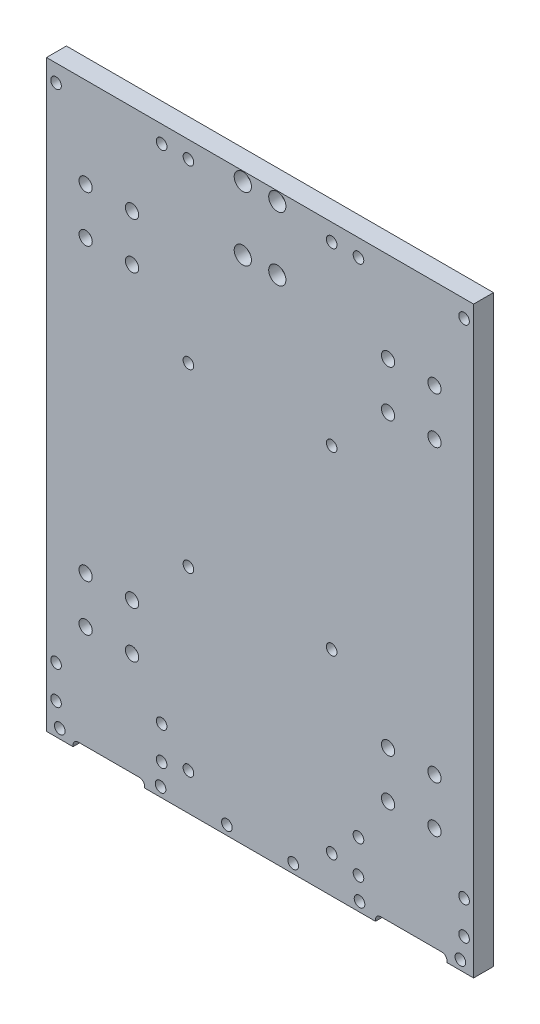
from build123d import *

# Parameters (mm, degrees)
SZKIC1_W                       = 322
SZKIC1_H                       = 440
DODANIE_WYCI_GNI_CIE1_DEPTH    = 15
SZKIC2_R                       = 3
WYTNIJ_WYCI_GNI_CIE1_DEPTH     = 15
SZKIC3_R                       = 5
WYTNIJ_WYCI_GNI_CIE2_DEPTH     = 7
SZYK_LINIOWY1_COUNT            = 2
SZYK_LINIOWY1_PITCH            = 35
SZYK_LINIOWY1_COUNT_DIR2       = 2
SZYK_LINIOWY1_PITCH_DIR2       = 35
SZYK_LINIOWY2_COPY_1_SKETCH_R  = 3
SZYK_LINIOWY2_COPY_1_DEPTH     = 15
SZYK_LINIOWY2_COPY_2_SKETCH_R  = 3
SZYK_LINIOWY2_COPY_2_DEPTH     = 15
SZYK_LINIOWY2_COPY_3_SKETCH_R  = 3
SZYK_LINIOWY2_COPY_3_DEPTH     = 15
SZYK_LINIOWY2_COPY_4_SKETCH_R  = 3
SZYK_LINIOWY2_COPY_4_DEPTH     = 15
SZYK_LINIOWY2_COPY_5_SKETCH_R  = 3
SZYK_LINIOWY2_COPY_5_DEPTH     = 15
SZYK_LINIOWY2_COPY_6_SKETCH_R  = 3
SZYK_LINIOWY2_COPY_6_DEPTH     = 15
SZYK_LINIOWY2_COPY_7_SKETCH_R  = 3
SZYK_LINIOWY2_COPY_7_DEPTH     = 15
SZYK_LINIOWY2_COPY_8_SKETCH_R  = 3
SZYK_LINIOWY2_COPY_8_DEPTH     = 15
SZYK_LINIOWY2_COPY_9_SKETCH_R  = 3
SZYK_LINIOWY2_COPY_9_DEPTH     = 15
SZYK_LINIOWY2_COPY_10_SKETCH_R = 5
SZYK_LINIOWY2_COPY_10_DEPTH    = 7
SZYK_LINIOWY2_COPY_11_SKETCH_R = 5
SZYK_LINIOWY2_COPY_11_DEPTH    = 7
SZYK_LINIOWY2_COPY_12_SKETCH_R = 5
SZYK_LINIOWY2_COPY_12_DEPTH    = 7
SZYK_LINIOWY2_COPY_13_SKETCH_R = 5
SZYK_LINIOWY2_COPY_13_DEPTH    = 7
SZYK_LINIOWY2_COPY_14_SKETCH_R = 5
SZYK_LINIOWY2_COPY_14_DEPTH    = 7
SZYK_LINIOWY2_COPY_15_SKETCH_R = 5
SZYK_LINIOWY2_COPY_15_DEPTH    = 7
SZYK_LINIOWY2_COPY_16_SKETCH_R = 5
SZYK_LINIOWY2_COPY_16_DEPTH    = 7
SZYK_LINIOWY2_COPY_17_SKETCH_R = 5
SZYK_LINIOWY2_COPY_17_DEPTH    = 7
SZYK_LINIOWY2_COPY_18_SKETCH_R = 5
SZYK_LINIOWY2_COPY_18_DEPTH    = 7
SZYK_LINIOWY2_COPY_19_SKETCH_R = 3
SZYK_LINIOWY2_COPY_19_DEPTH    = 15
SZYK_LINIOWY2_COPY_20_SKETCH_R = 3
SZYK_LINIOWY2_COPY_20_DEPTH    = 15
SZYK_LINIOWY2_COPY_21_SKETCH_R = 3
SZYK_LINIOWY2_COPY_21_DEPTH    = 15
SZYK_LINIOWY2_COPY_22_SKETCH_R = 5
SZYK_LINIOWY2_COPY_22_DEPTH    = 7
SZYK_LINIOWY2_COPY_23_SKETCH_R = 5
SZYK_LINIOWY2_COPY_23_DEPTH    = 7
SZYK_LINIOWY2_COPY_24_SKETCH_R = 5
SZYK_LINIOWY2_COPY_24_DEPTH    = 7
SZKIC6_R                       = 4
WYTNIJ_WYCI_GNI_CIE3_DEPTH     = 20
SZKIC7_R                       = 4
WYTNIJ_WYCI_GNI_CIE4_DEPTH     = 20
SZKIC10_R                      = 4
WYTNIJ_WYCI_GNI_CIE5_DEPTH     = 21
SZKIC11_R                      = 4
WYTNIJ_WYCI_GNI_CIE6_DEPTH     = 21
SZKIC12_R                      = 3.999999999
WYTNIJ_WYCI_GNI_CIE7_DEPTH     = 15
SZKIC13_R                      = 6.499999999
WYTNIJ_WYCI_GNI_CIE8_DEPTH     = 9
SZKIC14_R                      = 4
WYTNIJ_WYCI_GNI_CIE9_DEPTH     = 15
SZYK_LINIOWY3_COUNT            = 4
SZYK_LINIOWY3_PITCH            = 133
SZKIC22_W                      = 54
SZKIC22_H                      = 15
WYTNIJ_WYCI_GNI_CIE11_DEPTH    = 5
SZKIC24_W                      = 54
SZKIC24_H                      = 15
WYTNIJ_WYCI_GNI_CIE13_DEPTH    = 5
ZAOKR_GLENIE2_R                = 4
SZKIC25_R                      = 4
WYTNIJ_WYCI_GNI_CIE14_DEPTH    = 20
SZKIC26_R                      = 4
WYTNIJ_WYCI_GNI_CIE15_DEPTH    = 20
SZYK_LINIOWY4_COUNT            = 4
SZYK_LINIOWY4_PITCH            = 50


with BuildPart() as part:
    # Szkic1 → Dodanie-wyciągnięcie1 (new body)
    with BuildSketch(Plane.XY):
        Rectangle(SZKIC1_W, SZKIC1_H)
    extrude(amount=DODANIE_WYCI_GNI_CIE1_DEPTH)

    # Szkic2 → Wytnij-wyciągnięcie1 (cut)
    with BuildSketch(Plane.XY.offset(15)):
        with Locations((-131.5, 152)):
            Circle(SZKIC2_R)
    wytnij_wyci_gni_cie1 = extrude(amount=-WYTNIJ_WYCI_GNI_CIE1_DEPTH, mode=Mode.SUBTRACT)

    # Szkic3 → Wytnij-wyciągnięcie2 (cut)
    with BuildSketch(Plane.XY.offset(15)):
        with Locations((-131.5, 152)):
            Circle(SZKIC3_R)
    wytnij_wyci_gni_cie2 = extrude(amount=-WYTNIJ_WYCI_GNI_CIE2_DEPTH, mode=Mode.SUBTRACT)

    # Szyk liniowy1: Wytnij-wyciągnięcie1, Wytnij-wyci_gni_cie2 2 × 2
    with Locations(*[(i * SZYK_LINIOWY1_PITCH, -j * SZYK_LINIOWY1_PITCH_DIR2, 0) for i in range(SZYK_LINIOWY1_COUNT) for j in range(SZYK_LINIOWY1_COUNT_DIR2) if (i, j) != (0, 0)]):
        add(wytnij_wyci_gni_cie1, mode=Mode.SUBTRACT)
        add(wytnij_wyci_gni_cie2, mode=Mode.SUBTRACT)

    # Szyk liniowy2 copy 1 sketch → Szyk liniowy2 copy 1 (cut)
    with BuildSketch(Plane(origin=(0, -289, 15), x_dir=(1, 0, 0), z_dir=(0, 0, 1))):
        with Locations((-131.5, 152)):
            Circle(SZYK_LINIOWY2_COPY_1_SKETCH_R)
    extrude(amount=-SZYK_LINIOWY2_COPY_1_DEPTH, mode=Mode.SUBTRACT)

    # Szyk liniowy2 copy 2 sketch → Szyk liniowy2 copy 2 (cut)
    with BuildSketch(Plane(origin=(228, -35, 15), x_dir=(1, 0, 0), z_dir=(0, 0, 1))):
        with Locations((-131.5, 152)):
            Circle(SZYK_LINIOWY2_COPY_2_SKETCH_R)
    extrude(amount=-SZYK_LINIOWY2_COPY_2_DEPTH, mode=Mode.SUBTRACT)

    # Szyk liniowy2 copy 3 sketch → Szyk liniowy2 copy 3 (cut)
    with BuildSketch(Plane(origin=(228, -289, 15), x_dir=(1, 0, 0), z_dir=(0, 0, 1))):
        with Locations((-131.5, 152)):
            Circle(SZYK_LINIOWY2_COPY_3_SKETCH_R)
    extrude(amount=-SZYK_LINIOWY2_COPY_3_DEPTH, mode=Mode.SUBTRACT)

    # Szyk liniowy2 copy 4 sketch → Szyk liniowy2 copy 4 (cut)
    with BuildSketch(Plane(origin=(35, -254, 15), x_dir=(1, 0, 0), z_dir=(0, 0, 1))):
        with Locations((-131.5, 152)):
            Circle(SZYK_LINIOWY2_COPY_4_SKETCH_R)
    extrude(amount=-SZYK_LINIOWY2_COPY_4_DEPTH, mode=Mode.SUBTRACT)

    # Szyk liniowy2 copy 5 sketch → Szyk liniowy2 copy 5 (cut)
    with BuildSketch(Plane(origin=(263, 0, 15), x_dir=(1, 0, 0), z_dir=(0, 0, 1))):
        with Locations((-131.5, 152)):
            Circle(SZYK_LINIOWY2_COPY_5_SKETCH_R)
    extrude(amount=-SZYK_LINIOWY2_COPY_5_DEPTH, mode=Mode.SUBTRACT)

    # Szyk liniowy2 copy 6 sketch → Szyk liniowy2 copy 6 (cut)
    with BuildSketch(Plane(origin=(263, -254, 15), x_dir=(1, 0, 0), z_dir=(0, 0, 1))):
        with Locations((-131.5, 152)):
            Circle(SZYK_LINIOWY2_COPY_6_SKETCH_R)
    extrude(amount=-SZYK_LINIOWY2_COPY_6_DEPTH, mode=Mode.SUBTRACT)

    # Szyk liniowy2 copy 7 sketch → Szyk liniowy2 copy 7 (cut)
    with BuildSketch(Plane(origin=(35, -289, 15), x_dir=(1, 0, 0), z_dir=(0, 0, 1))):
        with Locations((-131.5, 152)):
            Circle(SZYK_LINIOWY2_COPY_7_SKETCH_R)
    extrude(amount=-SZYK_LINIOWY2_COPY_7_DEPTH, mode=Mode.SUBTRACT)

    # Szyk liniowy2 copy 8 sketch → Szyk liniowy2 copy 8 (cut)
    with BuildSketch(Plane(origin=(263, -35, 15), x_dir=(1, 0, 0), z_dir=(0, 0, 1))):
        with Locations((-131.5, 152)):
            Circle(SZYK_LINIOWY2_COPY_8_SKETCH_R)
    extrude(amount=-SZYK_LINIOWY2_COPY_8_DEPTH, mode=Mode.SUBTRACT)

    # Szyk liniowy2 copy 9 sketch → Szyk liniowy2 copy 9 (cut)
    with BuildSketch(Plane(origin=(263, -289, 15), x_dir=(1, 0, 0), z_dir=(0, 0, 1))):
        with Locations((-131.5, 152)):
            Circle(SZYK_LINIOWY2_COPY_9_SKETCH_R)
    extrude(amount=-SZYK_LINIOWY2_COPY_9_DEPTH, mode=Mode.SUBTRACT)

    # Szyk liniowy2 copy 10 sketch → Szyk liniowy2 copy 10 (cut)
    with BuildSketch(Plane(origin=(0, -289, 15), x_dir=(1, 0, 0), z_dir=(0, 0, 1))):
        with Locations((-131.5, 152)):
            Circle(SZYK_LINIOWY2_COPY_10_SKETCH_R)
    extrude(amount=-SZYK_LINIOWY2_COPY_10_DEPTH, mode=Mode.SUBTRACT)

    # Szyk liniowy2 copy 11 sketch → Szyk liniowy2 copy 11 (cut)
    with BuildSketch(Plane(origin=(228, -35, 15), x_dir=(1, 0, 0), z_dir=(0, 0, 1))):
        with Locations((-131.5, 152)):
            Circle(SZYK_LINIOWY2_COPY_11_SKETCH_R)
    extrude(amount=-SZYK_LINIOWY2_COPY_11_DEPTH, mode=Mode.SUBTRACT)

    # Szyk liniowy2 copy 12 sketch → Szyk liniowy2 copy 12 (cut)
    with BuildSketch(Plane(origin=(228, -289, 15), x_dir=(1, 0, 0), z_dir=(0, 0, 1))):
        with Locations((-131.5, 152)):
            Circle(SZYK_LINIOWY2_COPY_12_SKETCH_R)
    extrude(amount=-SZYK_LINIOWY2_COPY_12_DEPTH, mode=Mode.SUBTRACT)

    # Szyk liniowy2 copy 13 sketch → Szyk liniowy2 copy 13 (cut)
    with BuildSketch(Plane(origin=(35, -254, 15), x_dir=(1, 0, 0), z_dir=(0, 0, 1))):
        with Locations((-131.5, 152)):
            Circle(SZYK_LINIOWY2_COPY_13_SKETCH_R)
    extrude(amount=-SZYK_LINIOWY2_COPY_13_DEPTH, mode=Mode.SUBTRACT)

    # Szyk liniowy2 copy 14 sketch → Szyk liniowy2 copy 14 (cut)
    with BuildSketch(Plane(origin=(263, 0, 15), x_dir=(1, 0, 0), z_dir=(0, 0, 1))):
        with Locations((-131.5, 152)):
            Circle(SZYK_LINIOWY2_COPY_14_SKETCH_R)
    extrude(amount=-SZYK_LINIOWY2_COPY_14_DEPTH, mode=Mode.SUBTRACT)

    # Szyk liniowy2 copy 15 sketch → Szyk liniowy2 copy 15 (cut)
    with BuildSketch(Plane(origin=(263, -254, 15), x_dir=(1, 0, 0), z_dir=(0, 0, 1))):
        with Locations((-131.5, 152)):
            Circle(SZYK_LINIOWY2_COPY_15_SKETCH_R)
    extrude(amount=-SZYK_LINIOWY2_COPY_15_DEPTH, mode=Mode.SUBTRACT)

    # Szyk liniowy2 copy 16 sketch → Szyk liniowy2 copy 16 (cut)
    with BuildSketch(Plane(origin=(35, -289, 15), x_dir=(1, 0, 0), z_dir=(0, 0, 1))):
        with Locations((-131.5, 152)):
            Circle(SZYK_LINIOWY2_COPY_16_SKETCH_R)
    extrude(amount=-SZYK_LINIOWY2_COPY_16_DEPTH, mode=Mode.SUBTRACT)

    # Szyk liniowy2 copy 17 sketch → Szyk liniowy2 copy 17 (cut)
    with BuildSketch(Plane(origin=(263, -35, 15), x_dir=(1, 0, 0), z_dir=(0, 0, 1))):
        with Locations((-131.5, 152)):
            Circle(SZYK_LINIOWY2_COPY_17_SKETCH_R)
    extrude(amount=-SZYK_LINIOWY2_COPY_17_DEPTH, mode=Mode.SUBTRACT)

    # Szyk liniowy2 copy 18 sketch → Szyk liniowy2 copy 18 (cut)
    with BuildSketch(Plane(origin=(263, -289, 15), x_dir=(1, 0, 0), z_dir=(0, 0, 1))):
        with Locations((-131.5, 152)):
            Circle(SZYK_LINIOWY2_COPY_18_SKETCH_R)
    extrude(amount=-SZYK_LINIOWY2_COPY_18_DEPTH, mode=Mode.SUBTRACT)

    # Szyk liniowy2 copy 19 sketch → Szyk liniowy2 copy 19 (cut)
    with BuildSketch(Plane(origin=(0, -254, 15), x_dir=(1, 0, 0), z_dir=(0, 0, 1))):
        with Locations((-131.5, 152)):
            Circle(SZYK_LINIOWY2_COPY_19_SKETCH_R)
    extrude(amount=-SZYK_LINIOWY2_COPY_19_DEPTH, mode=Mode.SUBTRACT)

    # Szyk liniowy2 copy 20 sketch → Szyk liniowy2 copy 20 (cut)
    with BuildSketch(Plane(origin=(228, 0, 15), x_dir=(1, 0, 0), z_dir=(0, 0, 1))):
        with Locations((-131.5, 152)):
            Circle(SZYK_LINIOWY2_COPY_20_SKETCH_R)
    extrude(amount=-SZYK_LINIOWY2_COPY_20_DEPTH, mode=Mode.SUBTRACT)

    # Szyk liniowy2 copy 21 sketch → Szyk liniowy2 copy 21 (cut)
    with BuildSketch(Plane(origin=(228, -254, 15), x_dir=(1, 0, 0), z_dir=(0, 0, 1))):
        with Locations((-131.5, 152)):
            Circle(SZYK_LINIOWY2_COPY_21_SKETCH_R)
    extrude(amount=-SZYK_LINIOWY2_COPY_21_DEPTH, mode=Mode.SUBTRACT)

    # Szyk liniowy2 copy 22 sketch → Szyk liniowy2 copy 22 (cut)
    with BuildSketch(Plane(origin=(0, -254, 15), x_dir=(1, 0, 0), z_dir=(0, 0, 1))):
        with Locations((-131.5, 152)):
            Circle(SZYK_LINIOWY2_COPY_22_SKETCH_R)
    extrude(amount=-SZYK_LINIOWY2_COPY_22_DEPTH, mode=Mode.SUBTRACT)

    # Szyk liniowy2 copy 23 sketch → Szyk liniowy2 copy 23 (cut)
    with BuildSketch(Plane(origin=(228, 0, 15), x_dir=(1, 0, 0), z_dir=(0, 0, 1))):
        with Locations((-131.5, 152)):
            Circle(SZYK_LINIOWY2_COPY_23_SKETCH_R)
    extrude(amount=-SZYK_LINIOWY2_COPY_23_DEPTH, mode=Mode.SUBTRACT)

    # Szyk liniowy2 copy 24 sketch → Szyk liniowy2 copy 24 (cut)
    with BuildSketch(Plane(origin=(228, -254, 15), x_dir=(1, 0, 0), z_dir=(0, 0, 1))):
        with Locations((-131.5, 152)):
            Circle(SZYK_LINIOWY2_COPY_24_SKETCH_R)
    extrude(amount=-SZYK_LINIOWY2_COPY_24_DEPTH, mode=Mode.SUBTRACT)

    # Szkic6 → Wytnij-wyciągnięcie3 (cut)
    with BuildSketch(Plane.XY.offset(15)):
        with Locations((-153.8, 207)):
            Circle(SZKIC6_R)
        with Locations((-74.2, 207)):
            Circle(SZKIC6_R)
    extrude(amount=-WYTNIJ_WYCI_GNI_CIE3_DEPTH, mode=Mode.SUBTRACT)

    # Szkic7 → Wytnij-wyciągnięcie4 (cut)
    with BuildSketch(Plane.XY.offset(15)):
        with Locations((-153.8, -196.5)):
            Circle(SZKIC7_R)
        with Locations((-153.8, -171.5)):
            Circle(SZKIC7_R)
        with Locations((-74.2, -196.5)):
            Circle(SZKIC7_R)
        with Locations((-74.2, -171.5)):
            Circle(SZKIC7_R)
    extrude(amount=-WYTNIJ_WYCI_GNI_CIE4_DEPTH, mode=Mode.SUBTRACT)

    # Szkic10 → Wytnij-wyciągnięcie5 (cut)
    with BuildSketch(Plane.XY.offset(15)):
        with Locations((74.2, 207)):
            Circle(SZKIC10_R)
        with Locations((153.8, 207)):
            Circle(SZKIC10_R)
    extrude(amount=-WYTNIJ_WYCI_GNI_CIE5_DEPTH, mode=Mode.SUBTRACT)

    # Szkic11 → Wytnij-wyciągnięcie6 (cut)
    with BuildSketch(Plane.XY.offset(15)):
        with Locations((153.8, -171.5)):
            Circle(SZKIC11_R)
        with Locations((153.8, -196.5)):
            Circle(SZKIC11_R)
        with Locations((74.2, -196.5)):
            Circle(SZKIC11_R)
        with Locations((74.2, -171.5)):
            Circle(SZKIC11_R)
    extrude(amount=-WYTNIJ_WYCI_GNI_CIE6_DEPTH, mode=Mode.SUBTRACT)

    # Szkic12 → Wytnij-wyciągnięcie7 (cut)
    with BuildSketch(Plane.XY.offset(15)):
        with Locations((-13, 213)):
            Circle(SZKIC12_R)
        with Locations((13, 213)):
            Circle(SZKIC12_R)
        with Locations((-13, 165)):
            Circle(SZKIC12_R)
        with Locations((13, 165)):
            Circle(SZKIC12_R)
    extrude(amount=-WYTNIJ_WYCI_GNI_CIE7_DEPTH, mode=Mode.SUBTRACT)

    # Szkic13 → Wytnij-wyciągnięcie8 (cut)
    with BuildSketch(Plane.XY.offset(15)):
        with Locations((-13, 213)):
            Circle(SZKIC13_R)
        with Locations((13, 213)):
            Circle(SZKIC13_R)
        with Locations((13, 165)):
            Circle(SZKIC13_R)
        with Locations((-13, 165)):
            Circle(SZKIC13_R)
    extrude(amount=-WYTNIJ_WYCI_GNI_CIE8_DEPTH, mode=Mode.SUBTRACT)

    # Szkic14 → Wytnij-wyciągnięcie9 (cut)
    with BuildSketch(Plane.XY.offset(15)):
        with Locations((-54, 207)):
            Circle(SZKIC14_R)
        with Locations((54, 207)):
            Circle(SZKIC14_R)
    wytnij_wyci_gni_cie9 = extrude(amount=-WYTNIJ_WYCI_GNI_CIE9_DEPTH, mode=Mode.SUBTRACT)

    # Szyk liniowy3: Wytnij-wyciągnięcie9 ×4
    with Locations(*[(0, -i * SZYK_LINIOWY3_PITCH, 0) for i in range(1, SZYK_LINIOWY3_COUNT)]):
        add(wytnij_wyci_gni_cie9, mode=Mode.SUBTRACT)

    # Szkic22 → Wytnij-wyciągnięcie11 (cut)
    with BuildSketch(Plane.XZ.offset(220)):
        with Locations((-114, 7.5)):
            Rectangle(SZKIC22_W, SZKIC22_H)
    extrude(amount=-WYTNIJ_WYCI_GNI_CIE11_DEPTH, mode=Mode.SUBTRACT)

    # Szkic24 → Wytnij-wyciągnięcie13 (cut)
    with BuildSketch(Plane.XZ.offset(220)):
        with Locations((114, 7.5)):
            Rectangle(SZKIC24_W, SZKIC24_H)
    extrude(amount=-WYTNIJ_WYCI_GNI_CIE13_DEPTH, mode=Mode.SUBTRACT)

    # Zaokrąglenie2
    zaokr_glenie2_edges = [part.edges().sort_by_distance(p)[0] for p in [
        (87, -215, 7.5),
        (141, -215, 7.5),
        (-87, -215, 7.5),
        (-141, -215, 7.5),
    ]]
    fillet(zaokr_glenie2_edges, radius=ZAOKR_GLENIE2_R)

    # Szkic25 → Wytnij-wyciągnięcie14 (cut)
    with BuildSketch(Plane.XY.offset(15)):
        with Locations((-151, -213)):
            Circle(SZKIC25_R)
        with Locations((151, -213)):
            Circle(SZKIC25_R)
    extrude(amount=-WYTNIJ_WYCI_GNI_CIE14_DEPTH, mode=Mode.SUBTRACT)

    # Szkic26 → Wytnij-wyciągnięcie15 (cut)
    with BuildSketch(Plane.XY.offset(15)):
        with Locations((-75, -213)):
            Circle(SZKIC26_R)
    wytnij_wyci_gni_cie15 = extrude(amount=-WYTNIJ_WYCI_GNI_CIE15_DEPTH, mode=Mode.SUBTRACT)

    # Szyk liniowy4: Wytnij-wyciągnięcie15 ×4
    with Locations(*[(i * SZYK_LINIOWY4_PITCH, 0, 0) for i in range(1, SZYK_LINIOWY4_COUNT)]):
        add(wytnij_wyci_gni_cie15, mode=Mode.SUBTRACT)


solid = part.part
